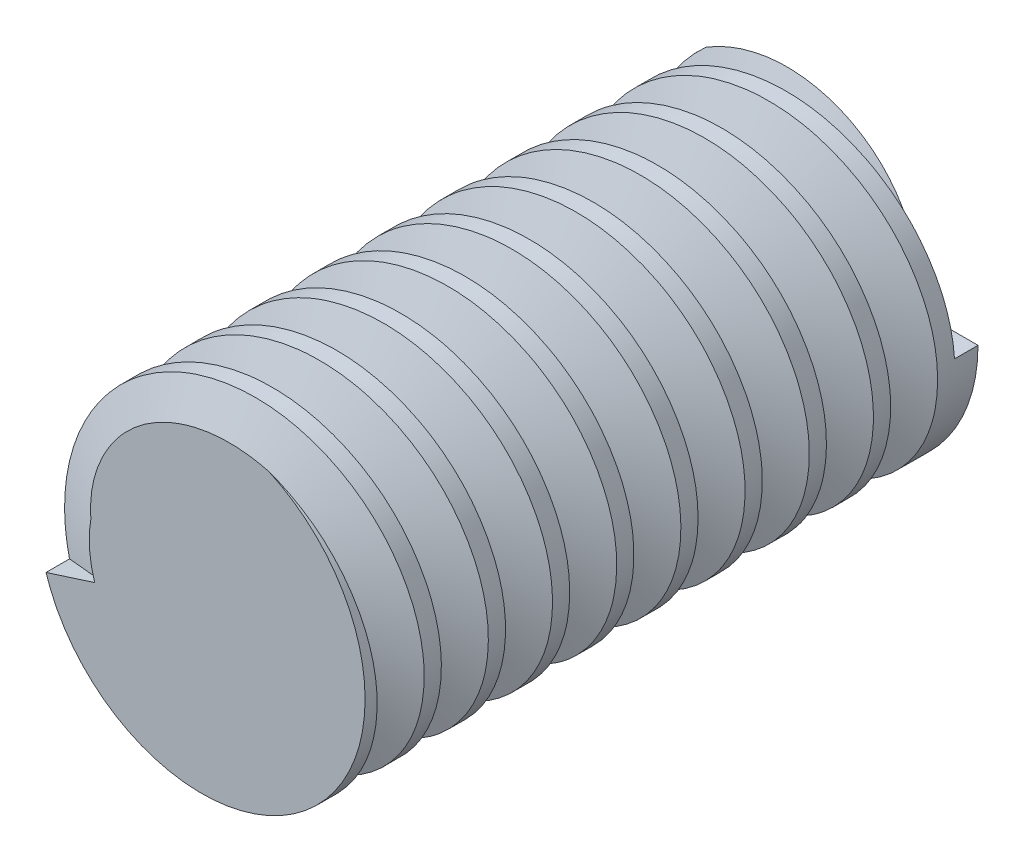
from build123d import *

# Parameters (mm, degrees)
BLANK_R      = 8
BODY_DEPTH   = 30
THREAD_PITCH = 3.141592654


with BuildPart() as part:
    # blank → body (new body)
    with BuildSketch(Plane.XY):
        Circle(BLANK_R)
    extrude(amount=BODY_DEPTH)

    # thread: the profile of groove screwed along a right-hand helix of 9.549297 turns, 10 arcs to a turn; built about Z, then put on its axis
    thread_z = Axis((0, 0, 0), (0, 0, 1))
    thread_corners = [(5.5, 0, -0.238051901), (5.5, 0, 0.238051901), (8.4, 0, 1.296254675), (8.4, 0, -1.296254675)]
    with BuildLine(mode=Mode.PRIVATE) as thread_profile:
        Line(thread_corners[0], thread_corners[1])
        Line(thread_corners[1], thread_corners[2])
        Line(thread_corners[2], thread_corners[3])
        Line(thread_corners[3], thread_corners[0])
    thread_cap = Face(thread_profile.wire())
    thread_turn_angles = [0, 18, 36, 54, 72, 90, 108, 126, 144, 162, 180, 198, 216, 234, 252, 270, 288, 306, 324, 342, 360]
    thread_turn_weights = [1, 0.9510565162951535, 1, 0.9510565162951535, 1, 0.9510565162951535, 1, 0.9510565162951535, 1, 0.9510565162951535, 1, 0.9510565162951535, 1, 0.9510565162951535, 1, 0.9510565162951535, 1, 0.9510565162951535, 1, 0.9510565162951535, 1]
    thread_turn_rails = [Edge.make_bspline([Vector(p[0], p[1], 0).rotate(thread_z, thread_turn_angles[k]) / thread_turn_weights[k] + Vector(0, 0, p[2] + THREAD_PITCH * thread_turn_angles[k] / 360) for k in range(21)], [0, 0, 0, 1, 1, 2, 2, 3, 3, 4, 4, 5, 5, 6, 6, 7, 7, 8, 8, 9, 9, 10, 10, 10], 2, thread_turn_weights) for p in thread_corners]
    thread_turn_sides = [Face.make_surface_from_curves(thread_turn_rails[p[0]], thread_turn_rails[p[1]]) for p in [(0, 1), (1, 2), (2, 3), (3, 0)]]
    thread_last_angles = [3240, 3258, 3276, 3294, 3312, 3330, 3348, 3366, 3384, 3402, 3420, 3428.873385392, 3437.746770785]
    thread_last_weights = [1, 0.9510565162951535, 1, 0.9510565162951535, 1, 0.9510565162951535, 1, 0.9510565162951535, 1, 0.9510565162951535, 1, 0.9880316240928656, 1]
    thread_last_rails = [Edge.make_bspline([Vector(p[0], p[1], 0).rotate(thread_z, thread_last_angles[k]) / thread_last_weights[k] + Vector(0, 0, p[2] + THREAD_PITCH * thread_last_angles[k] / 360) for k in range(13)], [0, 0, 0, 1, 1, 2, 2, 3, 3, 4, 4, 5, 5, 6, 6, 6], 2, thread_last_weights) for p in thread_corners]
    thread_last_sides = [Face.make_surface_from_curves(thread_last_rails[p[0]], thread_last_rails[p[1]]) for p in [(0, 1), (1, 2), (2, 3), (3, 0)]]
    thread = Plane(origin=(0, 0, 0), x_dir=(1, 0, 0), z_dir=(0, 0, 1)) * Solid(Shell([*[p.moved(Location((0, 0, THREAD_PITCH * i))) for i in range(9) for p in thread_turn_sides], *thread_last_sides, thread_cap, thread_cap.rotate(thread_z, 3437.746770785).moved(Location((0, 0, THREAD_PITCH * 3437.746770785 / 360)))]))
    add(thread, mode=Mode.SUBTRACT)


solid = part.part
